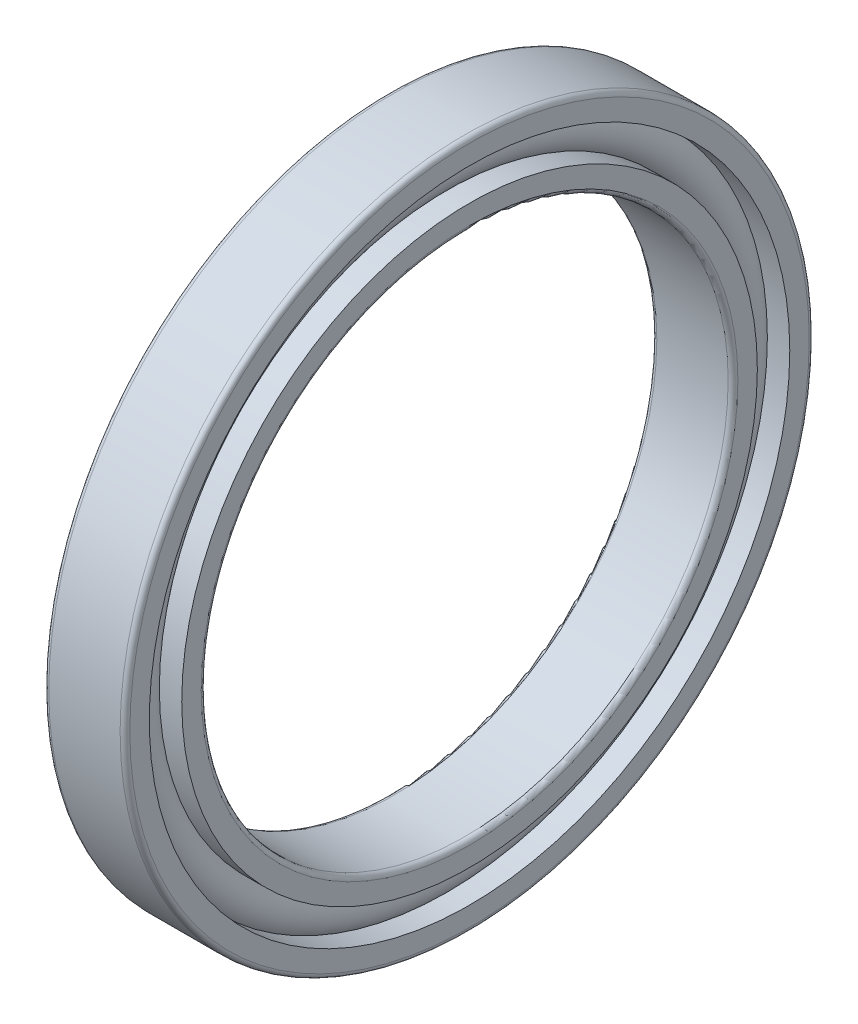
from build123d import *

# Parameters (mm, degrees)
CAGSPISKE_W     = 0.6
CAGSPISKE_H     = 1
CAGESPINE_ANGLE = 0.001
BALSIMSKE_R     = 3


with BuildPart() as part:
    # CagSpiSke → CageSpine (revolve)
    with BuildSketch(Plane.XY):
        with Locations((0, 37.5)):
            Rectangle(CAGSPISKE_W, CAGSPISKE_H)
    revolve(axis=Axis((-20.6375, 0, 0), (-1, 0, 0)), revolution_arc=CAGESPINE_ANGLE)

    # BalSimSke → BallsSimplified (revolve)
    with BuildSketch(Plane.XY):
        with Locations((0, 37.5)):
            Circle(BALSIMSKE_R)
    revolve(axis=Axis((-10, 0, 0), (1, 0, 0)))

    # InnRacSke → InnerRace (revolve)
    with BuildSketch(Plane.XY):
        with BuildLine():
            Line((-2.202413449, 35.5), (-5, 35.5))
            Line((-5, 35.5), (-5, 33.1))
            ThreePointArc((-5, 33.1), (-4.824264069, 32.675735931), (-4.4, 32.5))
            Line((-4.4, 32.5), (4.4, 32.5))
            ThreePointArc((4.4, 32.5), (4.824264069, 32.675735931), (5, 33.1))
            Line((5, 33.1), (5, 35.5))
            Line((5, 35.5), (2.202413449, 35.5))
            ThreePointArc((2.202413449, 35.5), (0, 34.525), (-2.202413449, 35.5))
        make_face()
    revolve(axis=Axis((-20.6375, 0, 0), (1, 0, 0)))

    # OutRacSke → OuterRace (revolve)
    with BuildSketch(Plane.XY):
        with BuildLine():
            Line((-2.202413449, 39.5), (-5, 39.5))
            Line((-5, 39.5), (-5, 41.9))
            ThreePointArc((-5, 41.9), (-4.824264069, 42.324264069), (-4.4, 42.5))
            Line((-4.4, 42.5), (4.4, 42.5))
            ThreePointArc((4.4, 42.5), (4.824264069, 42.324264069), (5, 41.9))
            Line((5, 41.9), (5, 39.5))
            Line((5, 39.5), (2.202413449, 39.5))
            ThreePointArc((2.202413449, 39.5), (0, 40.475), (-2.202413449, 39.5))
        make_face()
    revolve(axis=Axis((-20.6375, 0, 0), (1, 0, 0)))


solid = part.part
